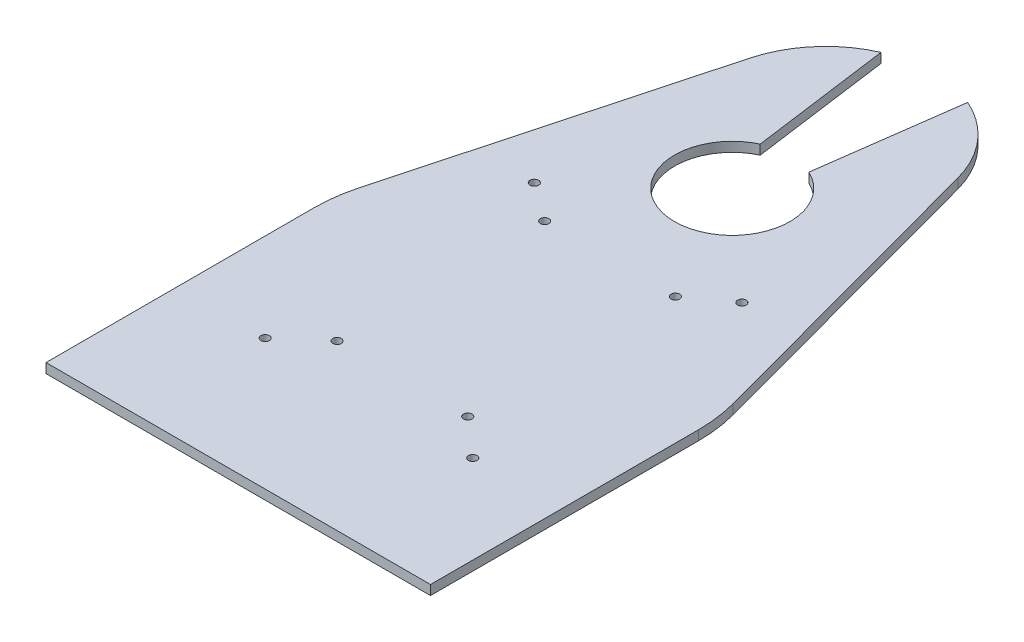
from build123d import *

# Parameters (mm, degrees)
SKETCH1_R           = 1.4224
BOSS_EXTRUDE2_DEPTH = 3.175


with BuildPart() as part:
    # Sketch1 → Boss-Extrude2 (new body)
    with BuildSketch(Plane(origin=(0, 0, 0), x_dir=(1, 0, 0), z_dir=(0, 1, 0))):
        with BuildLine():
            Line((0, 0), (127, 0))
            Line((127, 0), (127, 88.516943855))
            ThreePointArc((127, 88.516943855), (126.559592816, 95.191628223), (125.246007425, 101.750581135))
            Line((125.246007425, 101.750581135), (97.832205198, 203.350581135))
            ThreePointArc((97.832205198, 203.350581135), (90.468446293, 217.264966451), (77.819076691, 226.636653205))
            Line((77.819076691, 226.636653205), (71.529993195, 180.441813858))
            ThreePointArc((71.529993195, 180.441813858), (63.5, 144.116927193), (55.470006805, 180.441813858))
            Line((55.470006805, 180.441813858), (49.180923309, 226.636653205))
            ThreePointArc((49.180923309, 226.636653205), (36.531553707, 217.264966451), (29.167794802, 203.350581135))
            Line((29.167794802, 203.350581135), (1.753992575, 101.750581135))
            ThreePointArc((1.753992575, 101.750581135), (0.440407184, 95.191628223), (0, 88.516943855))
            Line((0, 88.516943855), (0, 0))
        make_face()
        with Locations((29.21, 43.18)):
            Circle(SKETCH1_R, mode=Mode.SUBTRACT)
        with Locations((29.21, 132.08)):
            Circle(SKETCH1_R, mode=Mode.SUBTRACT)
        with Locations((97.79, 43.18)):
            Circle(SKETCH1_R, mode=Mode.SUBTRACT)
        with Locations((97.79, 132.08)):
            Circle(SKETCH1_R, mode=Mode.SUBTRACT)
        with Locations((85.09, 54.228214828)):
            Circle(SKETCH1_R, mode=Mode.SUBTRACT)
        with Locations((85.09, 122.808214828)):
            Circle(SKETCH1_R, mode=Mode.SUBTRACT)
        with Locations((41.91, 122.808214828)):
            Circle(SKETCH1_R, mode=Mode.SUBTRACT)
        with Locations((41.91, 54.228214828)):
            Circle(SKETCH1_R, mode=Mode.SUBTRACT)
    extrude(amount=BOSS_EXTRUDE2_DEPTH)


solid = part.part
